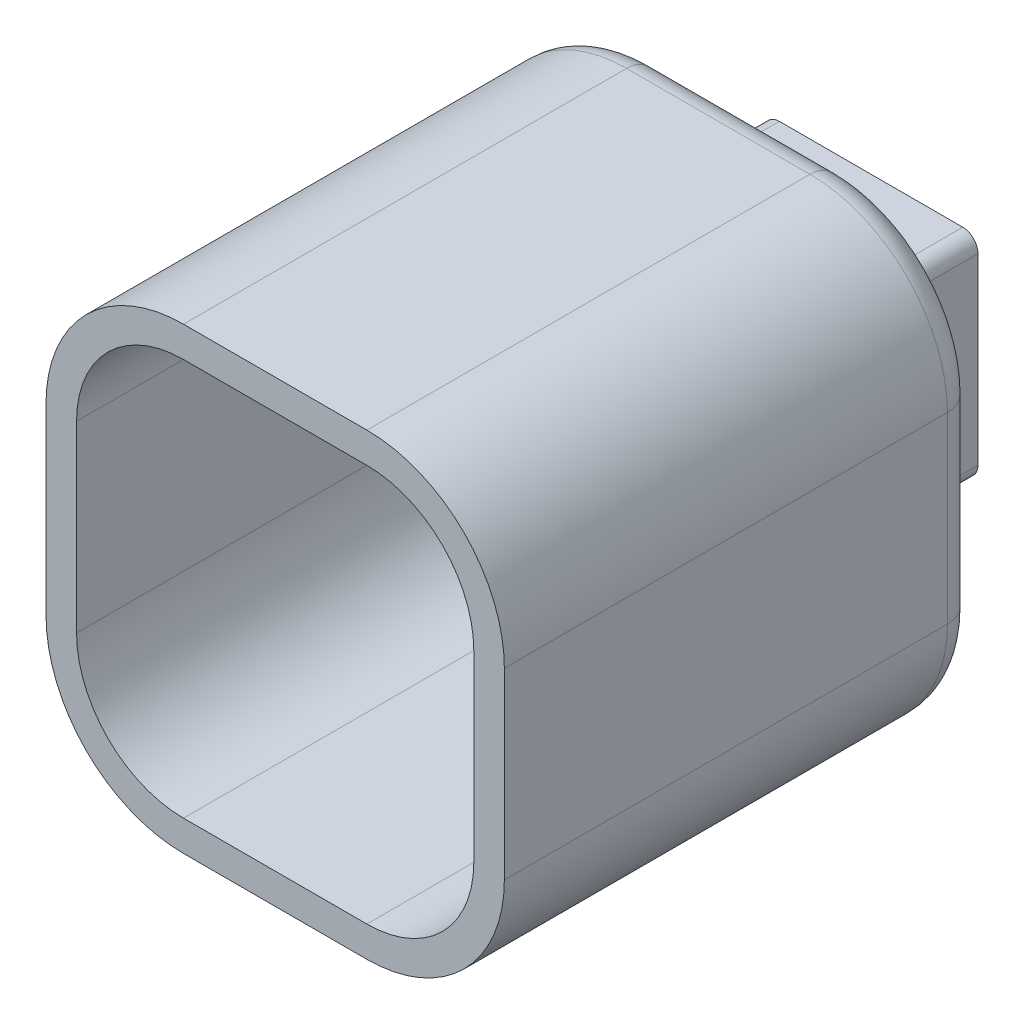
from build123d import *

# Parameters (mm, degrees)
SKETCH1_W           = 22.225
SKETCH1_H           = 22.225
BASE_EXTRUDE_DEPTH  = 12.7
FILLET1_R           = 1.5875
BOSS_EXTRUDE1_DEPTH = 49.2125
FILLET2_R           = 3.175
SHELL1_START        = 15.875
SHELL1_DEPTH        = 46.0375
SHELL1_2_OUTLINE_W  = 15.875
SHELL1_2_OUTLINE_H  = 15.875
SHELL1_2_DEPTH      = 15.875
FILLET4_R           = 1.5875


# Read off the part's stored shape, not the designer's step: Shell1
with BuildPart() as part:
    # Sketch1 → Base-Extrude (new body)
    with BuildSketch(Plane.XY):
        Rectangle(SKETCH1_W, SKETCH1_H)
    extrude(amount=BASE_EXTRUDE_DEPTH)

    # Fillet1
    fillet1_edges = [part.edges().sort_by_distance(p)[0] for p in [
        (-11.1125, 11.1125, 6.35),
        (11.1125, 11.1125, 6.35),
        (11.1125, -11.1125, 6.35),
        (-11.1125, -11.1125, 6.35),
    ]]
    fillet(fillet1_edges, radius=FILLET1_R)

    # Sketch2 → Boss-Extrude1 (add)
    with BuildSketch(Plane.XY.offset(12.7)):
        with BuildLine():
            Line((23.8125, -9.525), (23.8125, 9.525))
            ThreePointArc((23.8125, 9.525), (19.627788136, 19.627788136), (9.525, 23.8125))
            Line((9.525, 23.8125), (-9.525, 23.8125))
            ThreePointArc((-9.525, 23.8125), (-19.627788136, 19.627788136), (-23.8125, 9.525))
            Line((-23.8125, 9.525), (-23.8125, -9.525))
            ThreePointArc((-23.8125, -9.525), (-19.627788136, -19.627788136), (-9.525, -23.8125))
            Line((-9.525, -23.8125), (9.525, -23.8125))
            ThreePointArc((9.525, -23.8125), (19.627788136, -19.627788136), (23.8125, -9.525))
        make_face()
    extrude(amount=BOSS_EXTRUDE1_DEPTH)

    # Fillet2
    fillet2_edges = [part.edges().sort_by_distance(p)[0] for p in [
        (19.627788136, -19.627788136, 12.7),
        (23.8125, 0, 12.7),
        (19.627788136, 19.627788136, 12.7),
        (0, 23.8125, 12.7),
        (-19.627788136, 19.627788136, 12.7),
        (-23.8125, 0, 12.7),
        (-19.627788136, -19.627788136, 12.7),
        (0, -23.8125, 12.7),
    ]]
    fillet(fillet2_edges, radius=FILLET2_R)

    # Shell1 outline → Shell1 (cut)
    with BuildSketch(Plane.XY.offset(SHELL1_START)):
        with BuildLine():
            ThreePointArc((9.525, -20.6375), (17.382724106, -17.382724106), (20.6375, -9.525))
            Line((20.6375, -9.525), (20.6375, 9.525))
            ThreePointArc((20.6375, 9.525), (17.382724106, 17.382724106), (9.525, 20.6375))
            Line((9.525, 20.6375), (-9.525, 20.6375))
            ThreePointArc((-9.525, 20.6375), (-17.382724106, 17.382724106), (-20.6375, 9.525))
            Line((-20.6375, 9.525), (-20.6375, -9.525))
            ThreePointArc((-20.6375, -9.525), (-17.382724106, -17.382724106), (-9.525, -20.6375))
            Line((-9.525, -20.6375), (9.525, -20.6375))
        make_face()
    extrude(amount=SHELL1_DEPTH, mode=Mode.SUBTRACT)

    # Shell1 2 outline → Shell1 2 (cut)
    with BuildSketch(Plane.XY):
        Rectangle(SHELL1_2_OUTLINE_W, SHELL1_2_OUTLINE_H)
    extrude(amount=SHELL1_2_DEPTH, mode=Mode.SUBTRACT)

    # Fillet4
    fillet4_edges = [part.edges().sort_by_distance(p)[0] for p in [
        (0, -7.9375, 15.875),
        (0, 7.9375, 15.875),
        (-7.9375, 0, 15.875),
        (7.9375, 0, 15.875),
    ]]
    fillet(fillet4_edges, radius=FILLET4_R)


solid = part.part
